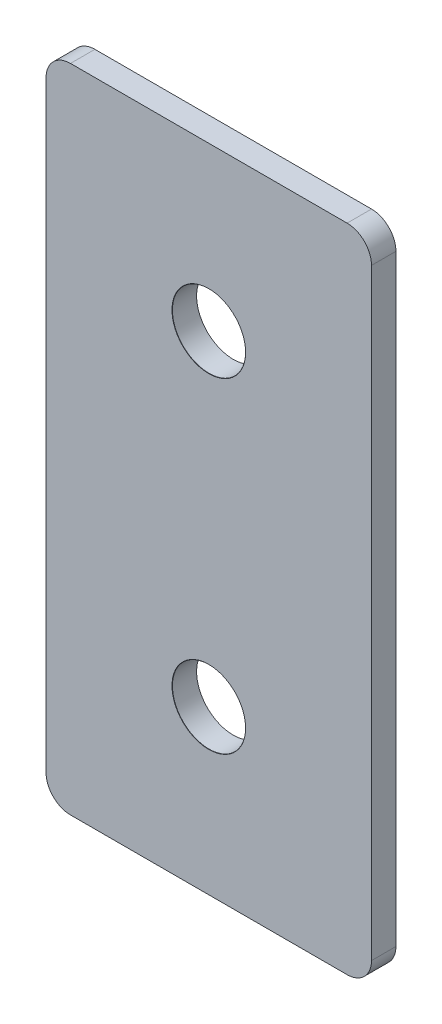
from build123d import *

# Parameters (mm, degrees)
SKETCH_1_W                   = 40
SKETCH_1_H                   = 80
SM_BASE_FLANGE_1_DEPTH       = 3
OTHER_START                  = -3
OTHER_1_DEPTH                = 3
HOLE_WIZARD_M8_1_D           = 9
HOLE_WIZARD_M8_1_DEPTH       = 12.4
HOLE_WIZARD_M8_1_CSINK_D     = 9.05
HOLE_WIZARD_M8_1_CSINK_ANGLE = 90
HOLE_WIZARD_M8_1_TIP         = 2.703872786


# Read off the part's stored shape, not the designer's step: 断开-边角1
# Sheet-metal steps are written as plain solids
with BuildPart() as part:
    # Sketch 1 → 基体-法兰1 (new body)
    with BuildSketch(Plane.XY):
        Rectangle(SKETCH_1_W, SKETCH_1_H)
    extrude(amount=-SM_BASE_FLANGE_1_DEPTH)

    # Other 1 outline → Other 1 (cut)
    with BuildSketch(Plane.XY.offset(OTHER_START)):
        with BuildLine():
            ThreePointArc((20, -37), (19.121320344, -39.121320344), (17, -40))
            Line((17, -40), (20, -40))
            Line((20, -40), (20, -37))
        make_face()
        with BuildLine():
            Line((-20, -40), (-17, -40))
            ThreePointArc((-17, -40), (-19.121320344, -39.121320344), (-20, -37))
            Line((-20, -37), (-20, -40))
        make_face()
        with BuildLine():
            ThreePointArc((17, 40), (19.121320344, 39.121320344), (20, 37))
            Line((20, 37), (20, 40))
            Line((20, 40), (17, 40))
        make_face()
        with BuildLine():
            Line((-20, 40), (-20, 37))
            ThreePointArc((-20, 37), (-19.121320344, 39.121320344), (-17, 40))
            Line((-17, 40), (-20, 40))
        make_face()
    extrude(amount=OTHER_1_DEPTH, mode=Mode.SUBTRACT)

    # M8 间隙孔1
    with Locations(Plane.XY):
        with Locations((0, 20), (0, -20)):
            CounterSinkHole(HOLE_WIZARD_M8_1_D / 2, HOLE_WIZARD_M8_1_CSINK_D / 2, depth=HOLE_WIZARD_M8_1_DEPTH, counter_sink_angle=HOLE_WIZARD_M8_1_CSINK_ANGLE)
            with Locations((0, 0, -(HOLE_WIZARD_M8_1_DEPTH + HOLE_WIZARD_M8_1_TIP / 2))):  # 118° drill point
                Cone(0, HOLE_WIZARD_M8_1_D / 2, HOLE_WIZARD_M8_1_TIP, mode=Mode.SUBTRACT)


solid = part.part
